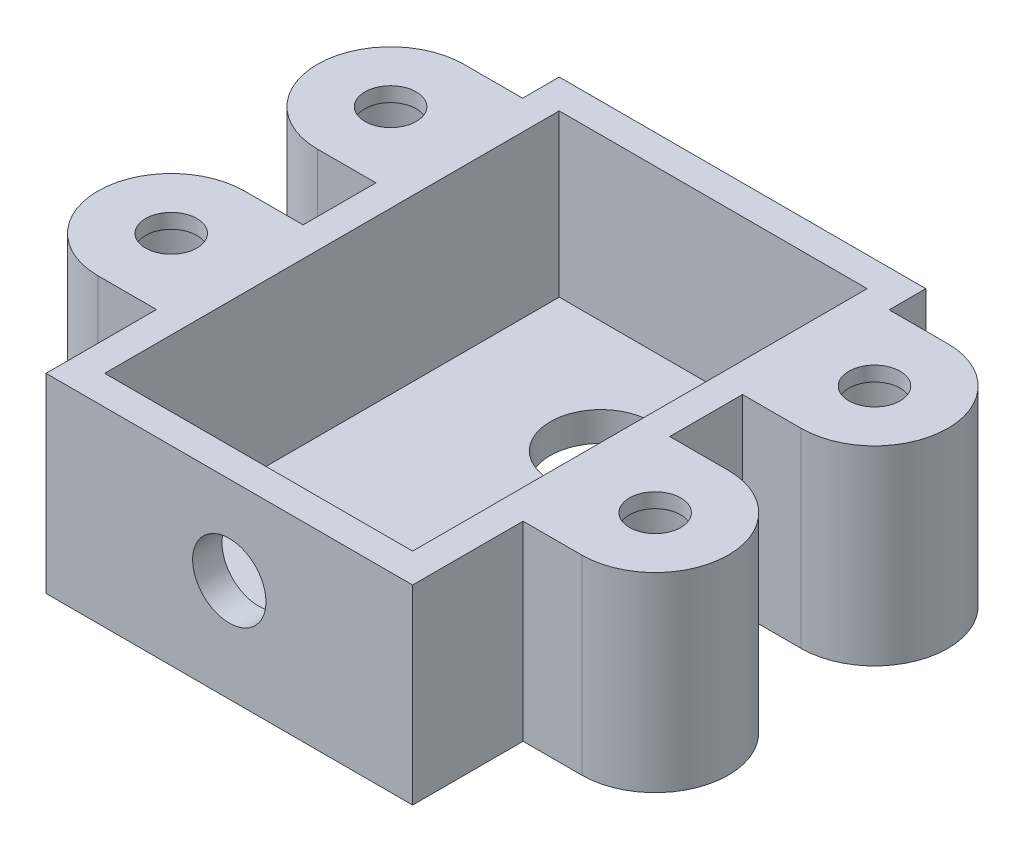
from build123d import *

# Parameters (mm, degrees)
SKETCH1_W              = 25
SKETCH1_H              = 35
SKETCH1_R              = 3.45
SKETCH1_R_2            = 1.5
BOSS_EXTRUDE1_DEPTH    = 13
SKETCH5_W              = 21
SKETCH5_H              = 31
CUT_EXTRUDE1_DEPTH     = 11
CUT_EXTRUDE2_REACH     = 41.373
SKETCH7_R              = 2.5
BOSS_EXTRUDE3_DEPTH    = 13
SKETCH11_R             = 3.25
CUT_EXTRUDE4_DEPTH     = 12
CUT_EXTRUDE5_START     = 12
CUT_EXTRUDE5_OUTLINE_R = 1.75
CUT_EXTRUDE5_DEPTH     = 1


# Read off the part's stored shape, not the designer's step: Cut-Extrude5
with BuildPart() as part:
    # Sketch1 → Boss-Extrude1 (new body)
    with BuildSketch(Plane(origin=(0, 0, 0), x_dir=(1, 0, 0), z_dir=(0, 1, 0))):
        with Locations((0, -7.840328725)):
            Rectangle(SKETCH1_W, SKETCH1_H)
        with Locations(Location((0, 0, 0), (0, 0, 90))):
            Circle(SKETCH1_R, mode=Mode.SUBTRACT)
        with Locations(Location((8.5, 0, 0), (0, 0, 90))):
            Circle(SKETCH1_R_2, mode=Mode.SUBTRACT)
    extrude(amount=BOSS_EXTRUDE1_DEPTH)

    # Sketch5 → Cut-Extrude1 (cut)
    with BuildSketch(Plane(origin=(0, 13, 0), x_dir=(1, 0, 0), z_dir=(0, 1, 0))):
        with Locations((0, -7.840328725)):
            Rectangle(SKETCH5_W, SKETCH5_H)
    extrude(amount=-CUT_EXTRUDE1_DEPTH, mode=Mode.SUBTRACT)

    # Sketch7 → Cut-Extrude2 (cut, up to next)
    with BuildSketch(Plane.XY.offset(25.340328725), mode=Mode.PRIVATE) as cut_extrude2_sk1:
        with Locations((0, 7)):
            Circle(SKETCH7_R)
    cut_extrude2_tool1 = extrude(cut_extrude2_sk1.sketch, amount=-CUT_EXTRUDE2_REACH, mode=Mode.PRIVATE) & part.part
    add(cut_extrude2_tool1.solids().sort_by_distance((0, 7, 25.340329))[0], mode=Mode.SUBTRACT)

    # Sketch9 → Boss-Extrude3 (add, through all)
    with BuildSketch(Plane(origin=(0, 13, 0), x_dir=(1, 0, 0), z_dir=(0, 1, 0))):
        with BuildLine():
            Line((-16.5, 7.159671275), (-12.5, 7.159671275))
            Line((-12.5, 7.159671275), (-12.5, -2.840328725))
            Line((-12.5, -2.840328725), (-16.5, -2.840328725))
            ThreePointArc((-16.5, -2.840328725), (-21.5, 2.159671275), (-16.5, 7.159671275))
        make_face()
        with BuildLine():
            Line((-16.5, -7.804369497), (-12.5, -7.804369497))
            Line((-12.5, -7.804369497), (-12.5, -17.804369497))
            Line((-12.5, -17.804369497), (-16.5, -17.804369497))
            ThreePointArc((-16.5, -17.804369497), (-21.5, -12.804369497), (-16.5, -7.804369497))
        make_face()
        with BuildLine():
            Line((12.5, -7.804369497), (12.5, -17.804369497))
            Line((12.5, -17.804369497), (16.5, -17.804369497))
            ThreePointArc((16.5, -17.804369497), (21.5, -12.804369497), (16.5, -7.804369497))
            Line((16.5, -7.804369497), (12.5, -7.804369497))
        make_face()
        with BuildLine():
            Line((12.5, 7.159671275), (12.5, -2.840328725))
            Line((12.5, -2.840328725), (16.5, -2.840328725))
            ThreePointArc((16.5, -2.840328725), (21.5, 2.159671275), (16.5, 7.159671275))
            Line((16.5, 7.159671275), (12.5, 7.159671275))
        make_face()
    extrude(amount=-BOSS_EXTRUDE3_DEPTH)

    # Sketch11 → Cut-Extrude4 (cut)
    with BuildSketch(Plane.XZ):
        with Locations(Location((-16.5, 12.800328725, 0), (0, 0, 270))):
            Circle(SKETCH11_R)
        with Locations(Location((-16.5, -2.159671275, 0), (0, 0, 270))):
            Circle(SKETCH11_R)
        with Locations(Location((16.5, 12.800328725, 0), (0, 0, 270))):
            Circle(SKETCH11_R)
        with Locations(Location((16.5, -2.159671275, 0), (0, 0, 270))):
            Circle(SKETCH11_R)
    extrude(amount=-CUT_EXTRUDE4_DEPTH, mode=Mode.SUBTRACT)

    # Cut-Extrude5 outline → Cut-Extrude5 (cut)
    with BuildSketch(Plane(origin=(0, 0, 0), x_dir=(1, 0, 0), z_dir=(0, 1, 0)).offset(CUT_EXTRUDE5_START)):
        with Locations((-16.5, 2.159671275)):
            Circle(CUT_EXTRUDE5_OUTLINE_R)
        with Locations((16.5, -12.800328725)):
            Circle(CUT_EXTRUDE5_OUTLINE_R)
        with Locations((16.5, 2.159671275)):
            Circle(CUT_EXTRUDE5_OUTLINE_R)
        with Locations((-16.5, -12.800328725)):
            Circle(CUT_EXTRUDE5_OUTLINE_R)
    extrude(amount=CUT_EXTRUDE5_DEPTH, mode=Mode.SUBTRACT)


solid = part.part
